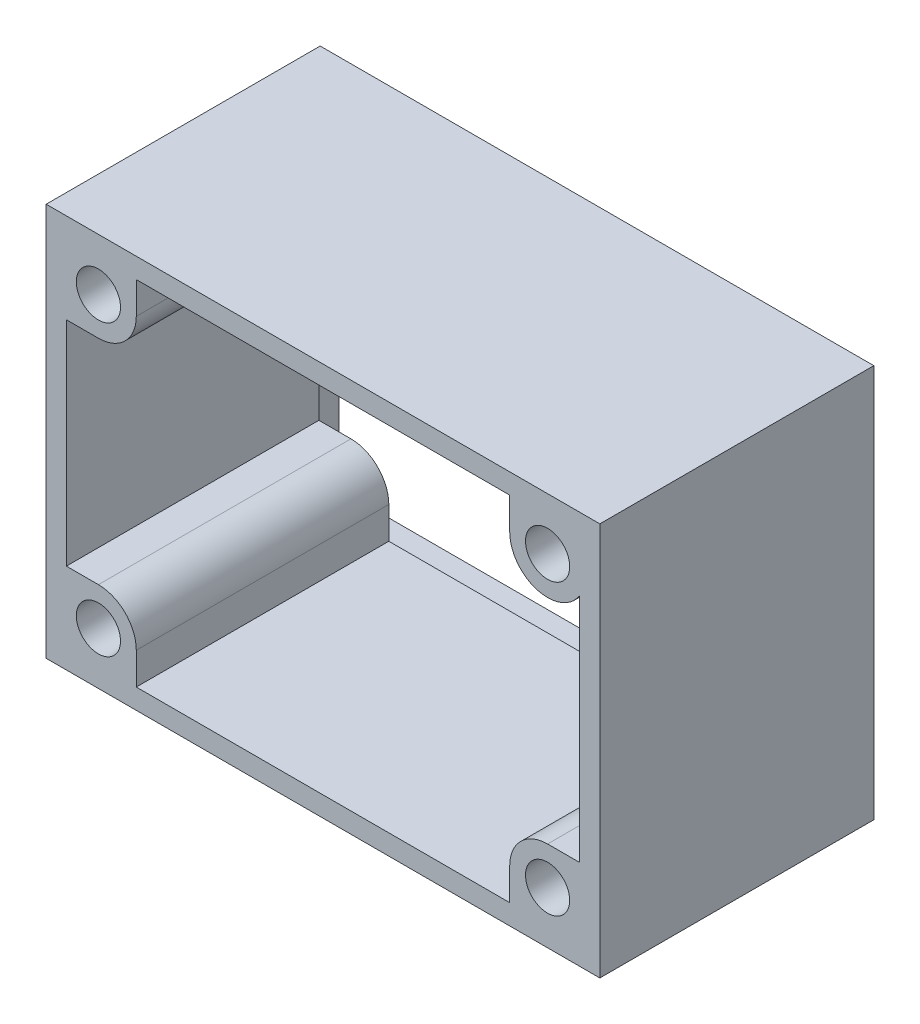
from build123d import *

# Parameters (mm, degrees)
SKETCH1_W           = 43.85
SKETCH1_H           = 31.15
SKETCH1_R           = 1.75
BOSS_EXTRUDE1_DEPTH = 20
SKETCH2_W           = 43.85
SKETCH2_H           = 31.15
SKETCH2_W_2         = 40.85
SKETCH2_H_2         = 28.15
BOSS_EXTRUDE2_DEPTH = 1.7


with BuildPart() as part:
    # Sketch1 → Boss-Extrude1 (new body)
    with BuildSketch(Plane.XY):
        Rectangle(SKETCH1_W, SKETCH1_H)
        with BuildLine():
            Line((20.325, -8.45), (17.7875, -8.45))
            ThreePointArc((17.7875, -8.45), (15.666179656, -9.328679656), (14.7875, -11.45))
            Line((14.7875, -11.45), (14.7875, -13.975))
            Line((14.7875, -13.975), (-14.7875, -13.975))
            Line((-14.7875, -13.975), (-14.7875, -11.45))
            ThreePointArc((-14.7875, -11.45), (-15.666179656, -9.328679656), (-17.7875, -8.45))
            Line((-17.7875, -8.45), (-20.325, -8.45))
            Line((-20.325, -8.45), (-20.325, 8.45))
            Line((-20.325, 8.45), (-17.7875, 8.45))
            ThreePointArc((-17.7875, 8.45), (-15.666179656, 9.328679656), (-14.7875, 11.45))
            Line((-14.7875, 11.45), (-14.7875, 13.975))
            Line((-14.7875, 13.975), (14.7875, 13.975))
            Line((14.7875, 13.975), (14.7875, 11.45))
            ThreePointArc((14.7875, 11.45), (16.954583438, 8.567943443), (20.325, 9.84965824))
            Line((20.325, 9.84965824), (20.325, -8.45))
        make_face(mode=Mode.SUBTRACT)
        with Locations((17.7875, 11.45)):
            Circle(SKETCH1_R, mode=Mode.SUBTRACT)
        with Locations((-17.7875, 11.45)):
            Circle(SKETCH1_R, mode=Mode.SUBTRACT)
        with Locations((-17.7875, -11.45)):
            Circle(SKETCH1_R, mode=Mode.SUBTRACT)
        with Locations((17.7875, -11.45)):
            Circle(SKETCH1_R, mode=Mode.SUBTRACT)
    extrude(amount=BOSS_EXTRUDE1_DEPTH)

    # Sketch2 → Boss-Extrude2 (add)
    with BuildSketch(Plane(origin=(0, 0, 0), x_dir=(-1, 0, 0), z_dir=(0, 0, -1))):
        Rectangle(SKETCH2_W, SKETCH2_H)
        Rectangle(SKETCH2_W_2, SKETCH2_H_2, mode=Mode.SUBTRACT)
    extrude(amount=BOSS_EXTRUDE2_DEPTH)


solid = part.part
